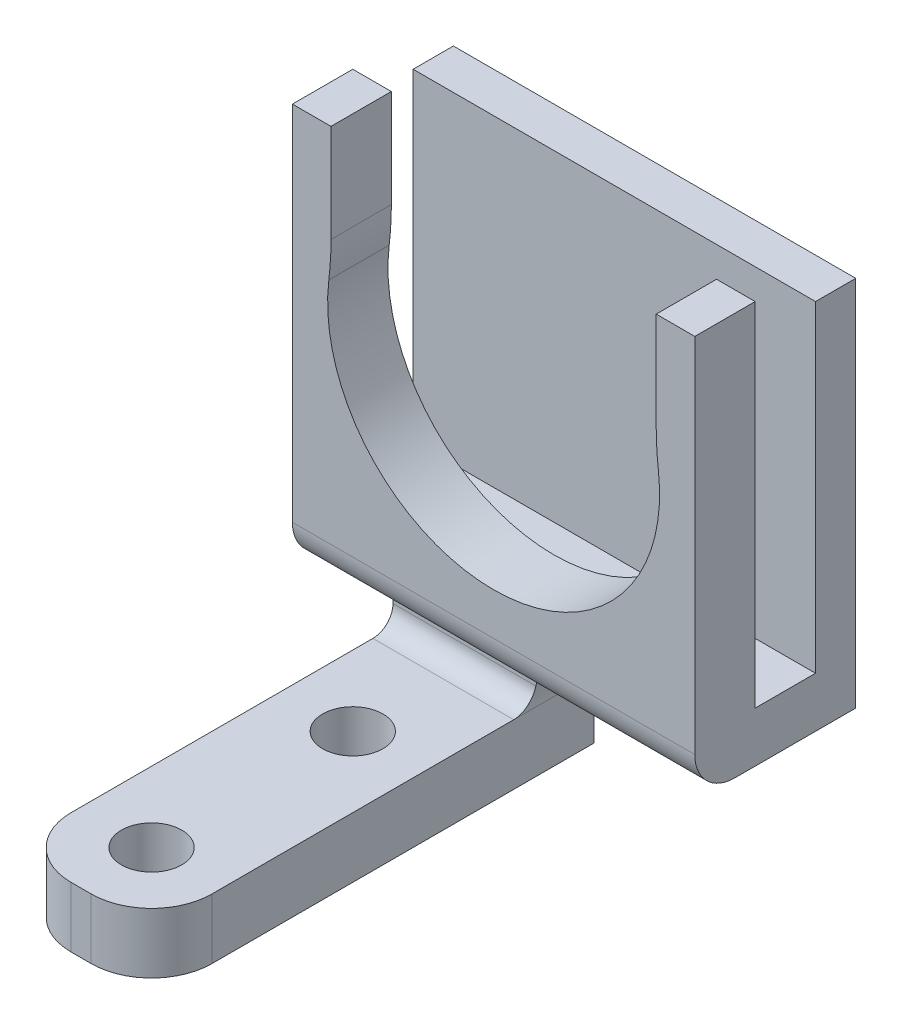
from build123d import *

# Parameters (mm, degrees)
BOSS_EXTRUDE1_DEPTH = 3
SKETCH2_W           = 20
SKETCH2_H           = 2.5
BOSS_EXTRUDE2_DEPTH = 5
SKETCH3_W           = 20
SKETCH3_H           = 2
BOSS_EXTRUDE3_DEPTH = 16
FILLET1_R           = 15
SKETCH4_W           = 7
SKETCH4_H           = 8
BOSS_EXTRUDE4_DEPTH = 5
SKETCH5_W           = 7
SKETCH5_H           = 3
BOSS_EXTRUDE5_DEPTH = 22
FILLET2_R           = 5
SKETCH7_W           = 5
SKETCH7_H           = 5
CUT_EXTRUDE1_DEPTH  = 34
FILLET3_R           = 2
CUT_EXTRUDE2_DEPTH  = 5
FILLET4_R           = 3
FILLET5_R           = 1


with BuildPart() as part:
    # Sketch1 → Boss-Extrude1 (new body)
    with BuildSketch(Plane.XY):
        with BuildLine():
            Line((18.08210451, 20), (20, 20))
            Line((20, 20), (20, 0))
            Line((20, 0), (0, 0))
            Line((0, 0), (0, 20))
            Line((0, 20), (1.91789549, 20))
            Line((1.91789549, 20), (1.91789549, 14))
            ThreePointArc((1.91789549, 14), (10, 4.094075277), (18.08210451, 14))
            Line((18.08210451, 14), (18.08210451, 20))
        make_face()
    extrude(amount=BOSS_EXTRUDE1_DEPTH)

    # Sketch2 → Boss-Extrude2 (add)
    with BuildSketch(Plane(origin=(0, 0, 0), x_dir=(-1, 0, 0), z_dir=(0, 0, -1))):
        with Locations((-10, 1.25)):
            Rectangle(SKETCH2_W, SKETCH2_H)
    extrude(amount=BOSS_EXTRUDE2_DEPTH)

    # Sketch3 → Boss-Extrude3 (add)
    with BuildSketch(Plane(origin=(0, 2.5, 0), x_dir=(1, 0, 0), z_dir=(0, 1, 0))):
        with Locations((10, 4)):
            Rectangle(SKETCH3_W, SKETCH3_H)
    extrude(amount=BOSS_EXTRUDE3_DEPTH)

    # Fillet1
    fillet1_edges = [part.edges().sort_by_distance(p)[0] for p in [
        (1.91789549, 14, 1.5),
        (18.08210451, 14, 1.5),
    ]]
    fillet(fillet1_edges, radius=FILLET1_R)

    # Sketch4 → Boss-Extrude4 (add)
    with BuildSketch(Plane.XZ):
        with Locations((3.5, -1)):
            Rectangle(SKETCH4_W, SKETCH4_H)
    extrude(amount=BOSS_EXTRUDE4_DEPTH)

    # Sketch5 → Boss-Extrude5 (add)
    with BuildSketch(Plane(origin=(0, 0, -5), x_dir=(-1, 0, 0), z_dir=(0, 0, -1))):
        with Locations((-3.5, -6.5)):
            Rectangle(SKETCH5_W, SKETCH5_H)
    extrude(amount=-BOSS_EXTRUDE5_DEPTH)

    # Fillet2
    fillet2_edges = [part.edges().sort_by_distance(p)[0] for p in [
        (7, 0, -1),
    ]]
    fillet(fillet2_edges, radius=FILLET2_R)

    # Sketch7 → Cut-Extrude1 (cut, through all)
    with BuildSketch(Plane.ZY):
        with Locations((0.5, -2.5)):
            Rectangle(SKETCH7_W, SKETCH7_H)
    extrude(amount=-CUT_EXTRUDE1_DEPTH, mode=Mode.SUBTRACT)

    # Fillet3
    fillet3_edges = [part.edges().sort_by_distance(p)[0] for p in [
        (10, 0, 3),
        (6, 0, -2),
    ]]
    fillet(fillet3_edges, radius=FILLET3_R)

    # Sketch6 → Cut-Extrude2 (cut)
    with BuildSketch(Plane(origin=(0, -8, 0), x_dir=(-1, 0, 0), z_dir=(0, -1, 0))):
        with BuildLine():
            ThreePointArc((-3.5, -2), (-5, -3.5), (-3.5, -5))
            Line((-3.5, -5), (-3.5, -2))
        make_face()
        with BuildLine():
            Line((-3.5, -2), (-3.5, -5))
            ThreePointArc((-3.5, -5), (-2.439339828, -4.560660172), (-2, -3.5))
            ThreePointArc((-2, -3.5), (-2.439339828, -2.439339828), (-3.5, -2))
        make_face()
        with BuildLine():
            ThreePointArc((-3.5, -12), (-5, -13.5), (-3.5, -15))
            Line((-3.5, -15), (-3.5, -12))
        make_face()
        with BuildLine():
            Line((-3.5, -12), (-3.5, -15))
            ThreePointArc((-3.5, -15), (-2.439339828, -14.560660172), (-2, -13.5))
            ThreePointArc((-2, -13.5), (-2.439339828, -12.439339828), (-3.5, -12))
        make_face()
    extrude(amount=-CUT_EXTRUDE2_DEPTH, mode=Mode.SUBTRACT)

    # Fillet4
    fillet4_edges = [part.edges().sort_by_distance(p)[0] for p in [
        (7, -6.5, 17),
        (0, -6.5, 17),
    ]]
    fillet(fillet4_edges, radius=FILLET4_R)

    # Fillet5
    # the kernel refuses this fillet: 1 mm, written as the material it adds along each edge
    with BuildSketch(Plane(origin=(0, -5, -2), x_dir=(0, 0, 1), z_dir=(1, 0, 0))) as fillet5_piece_1_section:
        with BuildLine():
            CenterArc((FILLET5_R, -FILLET5_R), FILLET5_R, 90, 90)
            Line((0, -FILLET5_R), (0, 0))
            Line((0, 0), (FILLET5_R, 0))
        make_face()
    fillet5_piece_1 = extrude(amount=9.5, mode=Mode.PRIVATE)
    fillet5_piece_1 = fillet5_piece_1 - Plane(origin=(12, -5, -1.773604886), x_dir=(-1, 0, 0), z_dir=(0, 0, -1)) * Cylinder(5, 23, mode=Mode.PRIVATE)
    add(fillet5_piece_1)


solid = part.part
